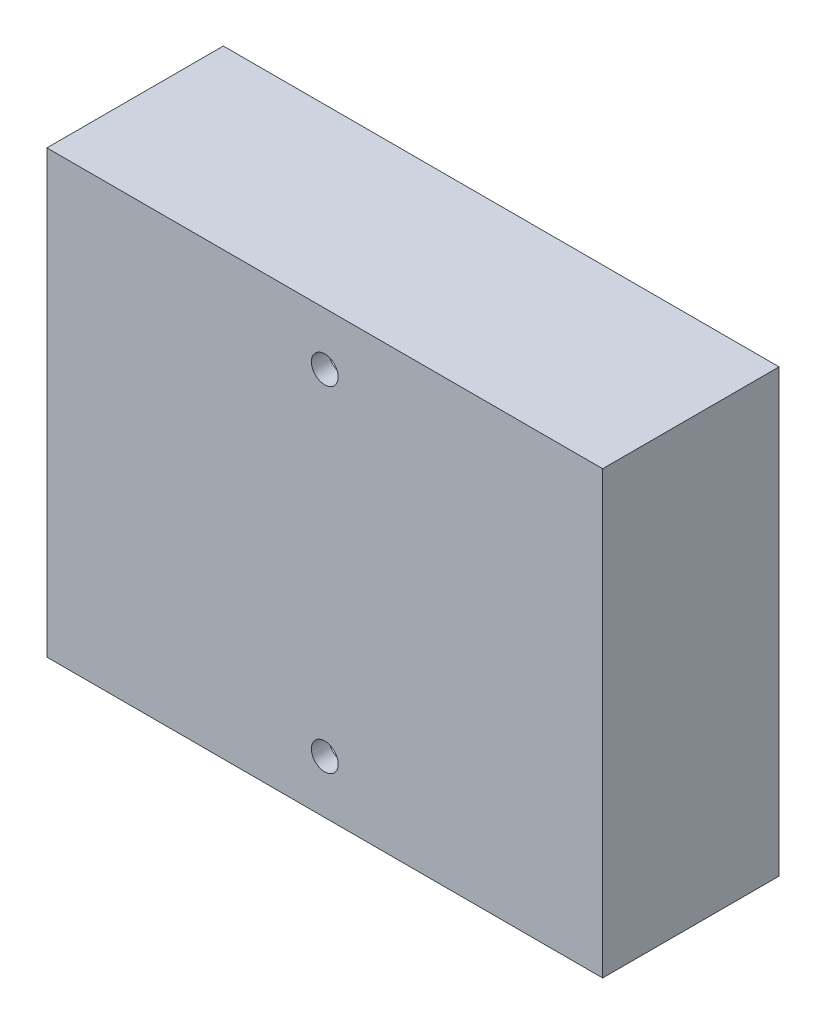
from build123d import *

# Parameters (mm, degrees)
SKETCH1_W             = 80.01
SKETCH1_H             = 63.5
BOSS_EXTRUDE1_DEPTH   = 25.4
SKETCH2_W             = 63.754
SKETCH2_H             = 57.15
CUT_EXTRUDE1_DEPTH    = 22.86
F_8_CLEARANCE_HOLE1_D = 3.8608
SKETCH13_W            = 20.32
SKETCH13_H            = 21.59
CUT_EXTRUDE3_DEPTH    = 50.8


with BuildPart() as part:
    # Sketch1 → Boss-Extrude1 (new body)
    with BuildSketch(Plane.XY):
        Rectangle(SKETCH1_W, SKETCH1_H)
    extrude(amount=BOSS_EXTRUDE1_DEPTH)

    # Sketch2 → Cut-Extrude1 (cut)
    with BuildSketch(Plane.XY):
        Rectangle(SKETCH2_W, SKETCH2_H)
    extrude(amount=CUT_EXTRUDE1_DEPTH, mode=Mode.SUBTRACT)

    # #8 Clearance Hole1 (through all)
    with Locations(Plane(origin=(0, 0, 0), x_dir=(-1, 0, 0), z_dir=(0, 0, -1))):
        with Locations((0, 24.13), (0, -24.13)):
            Hole(F_8_CLEARANCE_HOLE1_D / 2)

    # Sketch13 → Cut-Extrude3 (cut)
    with BuildSketch(Plane(origin=(0, 0, 0), x_dir=(1, 0, 0), z_dir=(0, 1, 0))):
        with Locations((0, -10.795)):
            Rectangle(SKETCH13_W, SKETCH13_H)
    extrude(amount=-CUT_EXTRUDE3_DEPTH, mode=Mode.SUBTRACT)


solid = part.part
